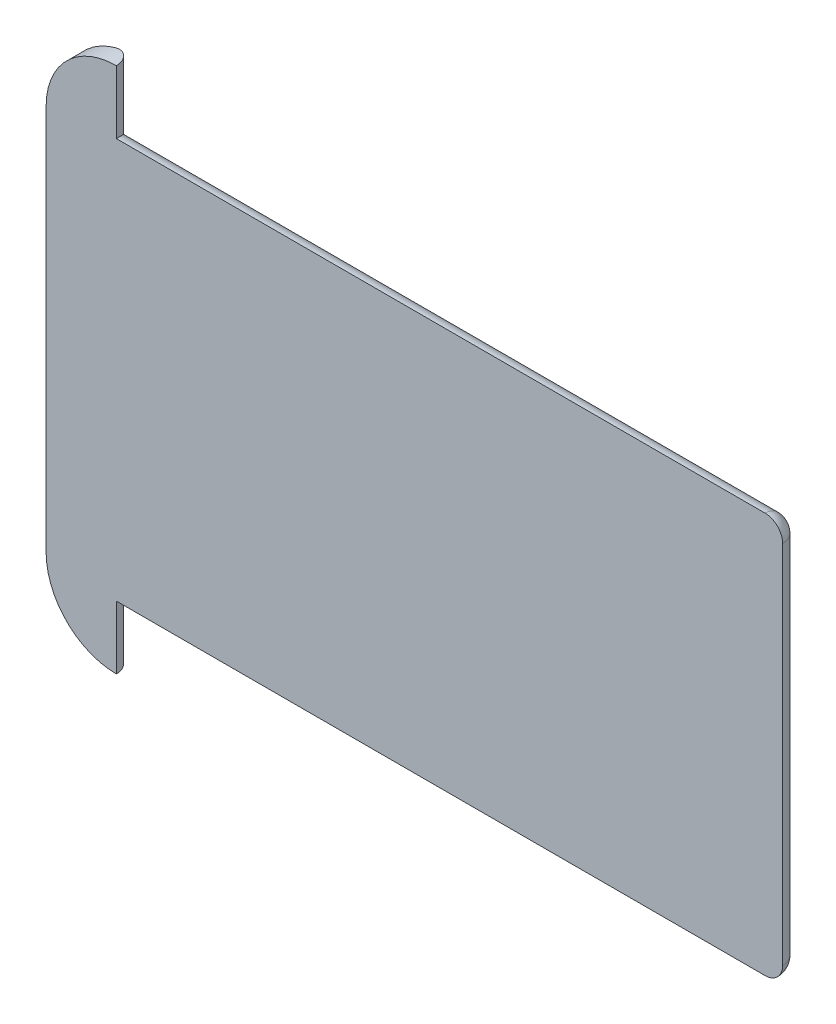
from build123d import *

# Parameters (mm, degrees)
BOSS_EXTRUDE1_DEPTH = 5
FILLET1_R           = 5
FILLET3_R           = 5
FILLET4_R           = 5


with BuildPart() as part:
    # Sketch1 → Boss-Extrude1 (new body)
    with BuildSketch(Plane.XY):
        with BuildLine():
            Line((-108.310248072, -37.693381192), (-108.310248072, -19.713755061))
            Line((-108.310248072, -19.713755061), (76.399052405, -19.713755061))
            ThreePointArc((76.399052405, -19.713755061), (79.934586311, -18.249288967), (81.399052405, -14.713755061))
            Line((81.399052405, -14.713755061), (81.399052405, 89.326992678))
            ThreePointArc((81.399052405, 89.326992678), (79.934586311, 92.862526584), (76.399052405, 94.326992678))
            Line((76.399052405, 94.326992678), (-108.310248072, 94.326992678))
            Line((-108.310248072, 94.326992678), (-108.310248072, 112.306618808))
            ThreePointArc((-108.310248072, 112.306618808), (-122.452383696, 106.448754432), (-128.310248072, 92.306618808))
            Line((-128.310248072, 92.306618808), (-128.310248072, -17.693381192))
            ThreePointArc((-128.310248072, -17.693381192), (-122.452383696, -31.835516815), (-108.310248072, -37.693381192))
        make_face()
    extrude(amount=BOSS_EXTRUDE1_DEPTH)

    # Fillet1
    fillet1_edges = [part.edges().sort_by_distance(p)[0] for p in [
        (-15.955597834, -19.713755061, 0),
        (79.934586311, -18.249288967, 0),
        (81.399052405, 37.306618808, 0),
        (79.934586311, 92.862526584, 0),
        (-15.955597834, 94.326992678, 0),
    ]]
    fillet(fillet1_edges, radius=FILLET1_R - 0.0001)  # a hair under: the kernel refuses the full size

    # Fillet3
    fillet3_edges = [part.edges().sort_by_distance(p)[0] for p in [
        (-108.310248072, 100.816855743, 0),
    ]]
    fillet(fillet3_edges, radius=FILLET3_R - 0.0001)  # a hair under: the kernel refuses the full size

    # Fillet4
    fillet4_edges = [part.edges().sort_by_distance(p)[0] for p in [
        (-108.310248072, -26.203618126, 0),
    ]]
    fillet(fillet4_edges, radius=FILLET4_R - 0.0001)  # a hair under: the kernel refuses the full size


solid = part.part
